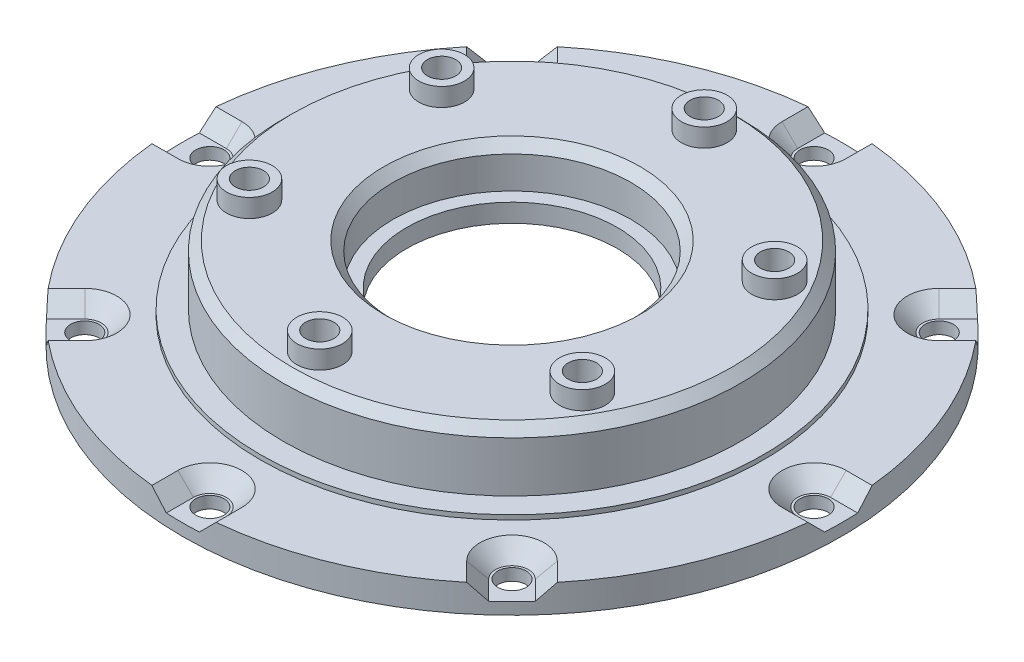
from build123d import *

# Parameters (mm, degrees)
SKETCH1_R                     = 36
BOSS_EXTRUDE1_DEPTH           = 3
SKETCH2_R                     = 27.5
BOSS_EXTRUDE2_DEPTH           = 0.5
SKETCH3_R                     = 25
BOSS_EXTRUDE3_DEPTH           = 6.5
SKETCH4_R                     = 13
CUT_EXTRUDE1_DEPTH            = 4.5
SKETCH5_R                     = 11.5
CUT_EXTRUDE2_DEPTH            = 5.5
SKETCH6_R                     = 1.55
CUT_EXTRUDE3_DEPTH            = 3
SKETCH8_R                     = 1.55
CUT_EXTRUDE5_DEPTH            = 10
SKETCH9_R                     = 2.15
CUT_EXTRUDE6_DEPTH            = 6
CHAMFER3_SIZE                 = 1
CUT_EXTRUDE7_DEPTH            = 1.7
CHAMFER6_SIZE                 = 1.7
CHAMFER7_SIZE                 = 1
CHAMFER7_SIZE2                = 0.700207538
CIRPATTERN1_COUNT             = 6
CHAMFER7_OF_CIRPATTERN1_SIZE2 = 0.700207538
CHAMFER7_OF_CIRPATTERN1_SIZE  = 1
SKETCH14_R                    = 16.5
CUT_EXTRUDE9_DEPTH            = 3.5
CHAMFER8_SIZE                 = 0.5
BOSS_EXTRUDE4_DEPTH           = 3
FILLET1_R                     = 1.5
CIRPATTERN2_COUNT             = 6
FILLET1_OF_CIRPATTERN2_R      = 1.5
CIRPATTERN3_COUNT             = 8
CHAMFER6_OF_CIRPATTERN3_SIZE  = 1.7
BOSS_EXTRUDE5_START           = 2
SKETCH16_R                    = 2.5
SKETCH16_R_2                  = 1.55
BOSS_EXTRUDE5_DEPTH           = 2
CIRPATTERN4_COUNT             = 6
CUT_EXTRUDE10_DEPTH           = 6.5
FILLET2_R                     = 1
CHAMFER9_SIZE                 = 0.5
CIRPATTERN5_COUNT             = 6
FILLET2_OF_CIRPATTERN5_R      = 1
CHAMFER9_OF_CIRPATTERN5_SIZE  = 0.5


with BuildPart() as part:
    # Sketch1 → Boss-Extrude1 (new body)
    with BuildSketch(Plane(origin=(0, 0, 0), x_dir=(1, 0, 0), z_dir=(0, 1, 0))):
        with Locations(Location((0, 0, 0), (0, 0, 270))):
            Circle(SKETCH1_R)
    extrude(amount=BOSS_EXTRUDE1_DEPTH)

    # Sketch2 → Boss-Extrude2 (add)
    with BuildSketch(Plane(origin=(0, 3, 0), x_dir=(1, 0, 0), z_dir=(0, 1, 0))):
        with Locations(Location((0, 0, 0), (0, 0, 270))):
            Circle(SKETCH2_R)
    extrude(amount=BOSS_EXTRUDE2_DEPTH)

    # Sketch3 → Boss-Extrude3 (add)
    with BuildSketch(Plane(origin=(0, 3.5, 0), x_dir=(1, 0, 0), z_dir=(0, 1, 0))):
        with Locations(Location((0, 0, 0), (0, 0, 90))):
            Circle(SKETCH3_R)
    extrude(amount=BOSS_EXTRUDE3_DEPTH)

    # Sketch4 → Cut-Extrude1 (cut)
    with BuildSketch(Plane(origin=(0, 10, 0), x_dir=(1, 0, 0), z_dir=(0, 1, 0))):
        with Locations(Location((0, 0, 0), (0, 0, 270))):
            Circle(SKETCH4_R)
    extrude(amount=-CUT_EXTRUDE1_DEPTH, mode=Mode.SUBTRACT)

    # Sketch5 → Cut-Extrude2 (cut)
    with BuildSketch(Plane(origin=(0, 5.5, 0), x_dir=(1, 0, 0), z_dir=(0, 1, 0))):
        with Locations(Location((0, 0, 0), (0, 0, 270))):
            Circle(SKETCH5_R)
    extrude(amount=-CUT_EXTRUDE2_DEPTH, mode=Mode.SUBTRACT)

    # Sketch6 → Cut-Extrude3 (cut)
    with BuildSketch(Plane(origin=(0, 3, 0), x_dir=(1, 0, 0), z_dir=(0, 1, 0))):
        with Locations(Location((0, 33, 0), (0, 0, 270))):
            Circle(SKETCH6_R)
    cut_extrude3 = extrude(amount=-CUT_EXTRUDE3_DEPTH, mode=Mode.SUBTRACT)

    # Sketch8 → Cut-Extrude5 (cut)
    with BuildSketch(Plane(origin=(0, 10, 0), x_dir=(1, 0, 0), z_dir=(0, 1, 0))):
        with Locations(Location((0, 21, 0), (0, 0, 270))):
            Circle(SKETCH8_R)
    cut_extrude5 = extrude(amount=-CUT_EXTRUDE5_DEPTH, mode=Mode.SUBTRACT)

    # Sketch9 → Cut-Extrude6 (cut)
    with BuildSketch(Plane.XZ):
        with Locations(Location((0, -21, 0), (0, 0, 270))):
            Circle(SKETCH9_R)
    cut_extrude6 = extrude(amount=-CUT_EXTRUDE6_DEPTH, mode=Mode.SUBTRACT)

    # Chamfer3
    chamfer3_edges = [part.edges().sort_by_distance(p)[0] for p in [
        (0, 10, 25),
        (0, 10, -13),
    ]]
    chamfer(chamfer3_edges, length=CHAMFER3_SIZE)

    # Sketch11 → Cut-Extrude7 (cut)
    with BuildSketch(Plane(origin=(0, 3, 0), x_dir=(1, 0, 0), z_dir=(0, 1, 0))):
        with BuildLine():
            Line((-3.5, 33), (-3.5, 37.877546272))
            Line((-3.5, 37.877546272), (3.5, 37.877546272))
            Line((3.5, 37.877546272), (3.5, 33))
            ThreePointArc((3.5, 33), (0, 29.5), (-3.5, 33))
        make_face()
    cut_extrude7 = extrude(amount=-CUT_EXTRUDE7_DEPTH, mode=Mode.SUBTRACT)

    # Chamfer6
    chamfer6_edges = [part.edges().sort_by_distance(p)[0] for p in [
        (-3.5, 1.3, -34.414728577),
        (3.5, 1.3, -34.414728577),
        (0, 1.3, -29.5),
    ]]
    chamfer(chamfer6_edges, length=CHAMFER6_SIZE - 0.0001)  # a hair under: the kernel refuses the full size

    # Chamfer7
    chamfer7_edges = [part.edges().sort_by_distance(p)[0] for p in [
        (0, 0, -18.85),
    ]]
    chamfer7_side = [part.faces().sort_by_distance(p)[0] for p in [
        (0, 0, -34.981766235),
    ]]
    chamfer(chamfer7_edges, length=CHAMFER7_SIZE, length2=CHAMFER7_SIZE2, reference=chamfer7_side[0])

    # CirPattern1: Cut-Extrude5, Cut-Extrude6 ×6 about axis
    cirpattern1_axis = Axis((0, 0, 0), (0, 1, 0))
    add([cut_extrude5.rotate(cirpattern1_axis, i * 360 / CIRPATTERN1_COUNT) for i in range(1, CIRPATTERN1_COUNT)], mode=Mode.SUBTRACT)
    add([cut_extrude6.rotate(cirpattern1_axis, i * 360 / CIRPATTERN1_COUNT) for i in range(1, CIRPATTERN1_COUNT)], mode=Mode.SUBTRACT)

    # Chamfer7 of CirPattern1
    chamfer7_of_cirpattern1_edges = [part.edges().sort_by_distance(p)[0] for p in [
        (-16.324578861, 0, -9.425),
        (-16.324578861, 0, 9.425),
        (0, 0, 18.85),
        (16.324578861, 0, 9.425),
        (16.324578861, 0, -9.425),
    ]]
    chamfer(chamfer7_of_cirpattern1_edges, length=CHAMFER7_OF_CIRPATTERN1_SIZE, length2=CHAMFER7_OF_CIRPATTERN1_SIZE2)

    # Sketch14 → Cut-Extrude9 (cut)
    with BuildSketch(Plane.XZ):
        with Locations(Location((0, 0, 0), (0, 0, 270))):
            Circle(SKETCH14_R)
    extrude(amount=-CUT_EXTRUDE9_DEPTH, mode=Mode.SUBTRACT)

    # Chamfer8
    chamfer8_edges = [part.edges().sort_by_distance(p)[0] for p in [
        (0, 0, 16.5),
        (0, 3.5, 16.5),
    ]]
    chamfer(chamfer8_edges, length=CHAMFER8_SIZE)

    # Sketch15 → Boss-Extrude4 (add)
    with BuildSketch(Plane.XZ):
        with BuildLine():
            Line((-15.137648208, 18.040346635), (-17.644519886, 21.027919964))
            ThreePointArc((-17.644519886, 21.027919964), (-13.725, 23.772397334), (-9.388452934, 25.794562441))
            Line((-9.388452934, 25.794562441), (-8.054574375, 22.12976122))
            ThreePointArc((-8.054574375, 22.12976122), (-11.775, 20.394898259), (-15.137648208, 18.040346635))
        make_face()
    boss_extrude4 = extrude(amount=BOSS_EXTRUDE4_DEPTH)

    # Fillet1
    fillet1_edges = [part.edges().sort_by_distance(p)[0] for p in [
        (-15.137648208, -1.5, 18.040346635),
        (-8.054574375, -1.5, 22.12976122),
        (-9.388452934, -1.5, 25.794562441),
        (-17.644519886, -1.5, 21.027919964),
        (-11.775, -3, 20.394898259),
        (-8.721513655, -3, 23.96216183),
        (-13.725, -3, 23.772397334),
        (-16.391084047, -3, 19.5341333),
    ]]
    fillet(fillet1_edges, radius=FILLET1_R)

    # CirPattern2: Boss-Extrude4 ×6 about axis
    cirpattern2_axis = Axis((0, 0, 0), (0, 1, 0))
    for i in range(1, CIRPATTERN2_COUNT):
        add(boss_extrude4.rotate(cirpattern2_axis, i * 360 / CIRPATTERN2_COUNT))

    # Fillet1 of CirPattern2
    fillet1_of_cirpattern2_edges = [part.edges().sort_by_distance(p)[0] for p in [
        (8.054574375, -1.5, 22.12976122),
        (15.137648208, -1.5, 18.040346635),
        (17.644519886, -1.5, 21.027919964),
        (9.388452934, -1.5, 25.794562441),
        (11.775, -3, 20.394898259),
        (16.391084047, -3, 19.5341333),
        (13.725, -3, 23.772397334),
        (8.721513655, -3, 23.96216183),
        (23.192222583, -1.5, 4.089414584),
        (23.192222583, -1.5, -4.089414584),
        (27.03297282, -1.5, -4.766642477),
        (27.03297282, -1.5, 4.766642477),
        (23.55, -3, 0),
        (25.112597702, -3, -4.428028531),
        (27.45, -3, 0),
        (25.112597702, -3, 4.428028531),
        (15.137648208, -1.5, -18.040346635),
        (8.054574375, -1.5, -22.12976122),
        (9.388452934, -1.5, -25.794562441),
        (17.644519886, -1.5, -21.027919964),
        (11.775, -3, -20.394898259),
        (8.721513655, -3, -23.96216183),
        (13.725, -3, -23.772397334),
        (16.391084047, -3, -19.5341333),
        (-8.054574375, -1.5, -22.12976122),
        (-15.137648208, -1.5, -18.040346635),
        (-17.644519886, -1.5, -21.027919964),
        (-9.388452934, -1.5, -25.794562441),
        (-11.775, -3, -20.394898259),
        (-16.391084047, -3, -19.5341333),
        (-13.725, -3, -23.772397334),
        (-8.721513655, -3, -23.96216183),
        (-23.192222583, -1.5, -4.089414584),
        (-23.192222583, -1.5, 4.089414584),
        (-27.03297282, -1.5, 4.766642477),
        (-27.03297282, -1.5, -4.766642477),
        (-23.55, -3, 0),
        (-25.112597702, -3, 4.428028531),
        (-27.45, -3, 0),
        (-25.112597702, -3, -4.428028531),
    ]]
    fillet(fillet1_of_cirpattern2_edges, radius=FILLET1_OF_CIRPATTERN2_R)

    # CirPattern3: Cut-Extrude3, Cut-Extrude7 ×8 about axis
    cirpattern3_axis = Axis((0, 0, 0), (0, 1, 0))
    add([cut_extrude3.rotate(cirpattern3_axis, i * 360 / CIRPATTERN3_COUNT) for i in range(1, CIRPATTERN3_COUNT)], mode=Mode.SUBTRACT)
    add([cut_extrude7.rotate(cirpattern3_axis, i * 360 / CIRPATTERN3_COUNT) for i in range(1, CIRPATTERN3_COUNT)], mode=Mode.SUBTRACT)

    # Chamfer6 of CirPattern3
    chamfer6_of_cirpattern3_edges = [part.edges().sort_by_distance(p)[0] for p in [
        (-26.809761684, 1.3, -21.860014216),
        (-21.860014216, 1.3, -26.809761684),
        (-20.859650045, 1.3, -20.859650045),
        (-34.414728577, 1.3, 3.5),
        (-34.414728577, 1.3, -3.5),
        (-29.5, 1.3, 0),
        (-21.860014216, 1.3, 26.809761684),
        (-26.809761684, 1.3, 21.860014216),
        (-20.859650045, 1.3, 20.859650045),
        (3.5, 1.3, 34.414728577),
        (-3.5, 1.3, 34.414728577),
        (0, 1.3, 29.5),
        (26.809761684, 1.3, 21.860014216),
        (21.860014216, 1.3, 26.809761684),
        (20.859650045, 1.3, 20.859650045),
        (34.414728577, 1.3, -3.5),
        (34.414728577, 1.3, 3.5),
        (29.5, 1.3, 0),
        (21.860014216, 1.3, -26.809761684),
        (26.809761684, 1.3, -21.860014216),
        (20.859650045, 1.3, -20.859650045),
    ]]
    chamfer(chamfer6_of_cirpattern3_edges, length=CHAMFER6_OF_CIRPATTERN3_SIZE - 0.0001)  # a hair under: the kernel refuses the full size

    # Sketch16 → Boss-Extrude5 (add)
    with BuildSketch(Plane(origin=(0, 10, 0), x_dir=(1, 0, 0), z_dir=(0, 1, 0)).offset(BOSS_EXTRUDE5_START)):
        with Locations(Location((0, 21, 0), (0, 0, 270))):
            Circle(SKETCH16_R)
        with Locations(Location((0, 21, 0), (0, 0, 270))):
            Circle(SKETCH16_R_2, mode=Mode.SUBTRACT)
    boss_extrude5 = extrude(amount=-BOSS_EXTRUDE5_DEPTH)

    # CirPattern4: Boss-Extrude5 ×6 about axis
    cirpattern4_axis = Axis((0, 0, 0), (0, 1, 0))
    for i in range(1, CIRPATTERN4_COUNT):
        add(boss_extrude5.rotate(cirpattern4_axis, i * 360 / CIRPATTERN4_COUNT))

    # Sketch18 → Cut-Extrude10 (cut)
    with BuildSketch(Plane.XZ):
        with BuildLine():
            Line((-15.909902577, 15.909902577), (-13.081475452, 13.081475452))
            ThreePointArc((-13.081475452, 13.081475452), (-9.25, 16.02146997), (-4.788152334, 17.869627786))
            Line((-4.788152334, 17.869627786), (-5.823428515, 21.733331092))
            ThreePointArc((-5.823428515, 21.733331092), (-11.25, 19.485571585), (-15.909902577, 15.909902577))
        make_face()
    cut_extrude10 = extrude(amount=-CUT_EXTRUDE10_DEPTH, mode=Mode.SUBTRACT)

    # Fillet2
    fillet2_edges = [part.edges().sort_by_distance(p)[0] for p in [
        (-15.909902577, 3.25, 15.909902577),
        (-5.823428515, 3.25, 21.733331092),
        (-4.788152334, 3.25, 17.869627786),
        (-13.081475452, 3.25, 13.081475452),
    ]]
    fillet(fillet2_edges, radius=FILLET2_R)

    # Chamfer9
    chamfer9_edges = [part.edges().sort_by_distance(p)[0] for p in [
        (-14.478390951, 0, 14.478390951),
        (-11.25, 0, 19.485571585),
        (-9.25, 0, 16.02146997),
        (-5.299458894, 0, 19.777849845),
        (-15.478965168, 0, 15.916711438),
        (-13.088982037, 0, 13.477875137),
        (-5.127691239, 0, 18.074328522),
        (-6.044793866, 0, 21.363532779),
    ]]
    chamfer(chamfer9_edges, length=CHAMFER9_SIZE)

    # CirPattern5: Cut-Extrude10 ×6 about axis
    cirpattern5_axis = Axis((0, 0, 0), (0, 1, 0))
    for i in range(1, CIRPATTERN5_COUNT):
        add(cut_extrude10.rotate(cirpattern5_axis, i * 360 / CIRPATTERN5_COUNT), mode=Mode.SUBTRACT)

    # Fillet2 of CirPattern5
    fillet2_of_cirpattern5_edges = [part.edges().sort_by_distance(p)[0] for p in [
        (5.823428515, 3.25, 21.733331092),
        (15.909902577, 3.25, 15.909902577),
        (13.081475452, 3.25, 13.081475452),
        (4.788152334, 3.25, 17.869627786),
        (21.733331092, 3.25, 5.823428515),
        (21.733331092, 3.25, -5.823428515),
        (17.869627786, 3.25, -4.788152334),
        (17.869627786, 3.25, 4.788152334),
        (15.909902577, 3.25, -15.909902577),
        (5.823428515, 3.25, -21.733331092),
        (4.788152334, 3.25, -17.869627786),
        (13.081475452, 3.25, -13.081475452),
        (-5.823428515, 3.25, -21.733331092),
        (-15.909902577, 3.25, -15.909902577),
        (-13.081475452, 3.25, -13.081475452),
        (-4.788152334, 3.25, -17.869627786),
        (-21.733331092, 3.25, -5.823428515),
        (-21.733331092, 3.25, 5.823428515),
        (-17.869627786, 3.25, 4.788152334),
        (-17.869627786, 3.25, -4.788152334),
    ]]
    fillet(fillet2_of_cirpattern5_edges, radius=FILLET2_OF_CIRPATTERN5_R)

    # Chamfer9 of CirPattern5
    chamfer9_of_cirpattern5_edges = [part.edges().sort_by_distance(p)[0] for p in [
        (5.299458894, 0, 19.777849845),
        (11.25, 0, 19.485571585),
        (9.25, 0, 16.02146997),
        (14.478390951, 0, 14.478390951),
        (6.044793866, 0, 21.363532779),
        (5.127691239, 0, 18.074328522),
        (13.088982037, 0, 13.477875137),
        (15.478965168, 0, 15.916711438),
        (19.777849845, 0, 5.299458894),
        (22.5, 0, 0),
        (18.5, 0, 0),
        (19.777849845, 0, -5.299458894),
        (21.523759034, 0, 5.44682134),
        (18.216673276, 0, 4.596453385),
        (18.216673276, 0, -4.596453385),
        (21.523759034, 0, -5.44682134),
        (14.478390951, 0, -14.478390951),
        (11.25, 0, -19.485571585),
        (9.25, 0, -16.02146997),
        (5.299458894, 0, -19.777849845),
        (15.478965168, 0, -15.916711438),
        (13.088982037, 0, -13.477875137),
        (5.127691239, 0, -18.074328522),
        (6.044793866, 0, -21.363532779),
        (-5.299458894, 0, -19.777849845),
        (-11.25, 0, -19.485571585),
        (-9.25, 0, -16.02146997),
        (-14.478390951, 0, -14.478390951),
        (-6.044793866, 0, -21.363532779),
        (-5.127691239, 0, -18.074328522),
        (-13.088982037, 0, -13.477875137),
        (-15.478965168, 0, -15.916711438),
        (-19.777849845, 0, -5.299458894),
        (-22.5, 0, 0),
        (-18.5, 0, 0),
        (-19.777849845, 0, 5.299458894),
        (-21.523759034, 0, -5.44682134),
        (-18.216673276, 0, -4.596453385),
        (-18.216673276, 0, 4.596453385),
        (-21.523759034, 0, 5.44682134),
    ]]
    chamfer(chamfer9_of_cirpattern5_edges, length=CHAMFER9_OF_CIRPATTERN5_SIZE)


solid = part.part
